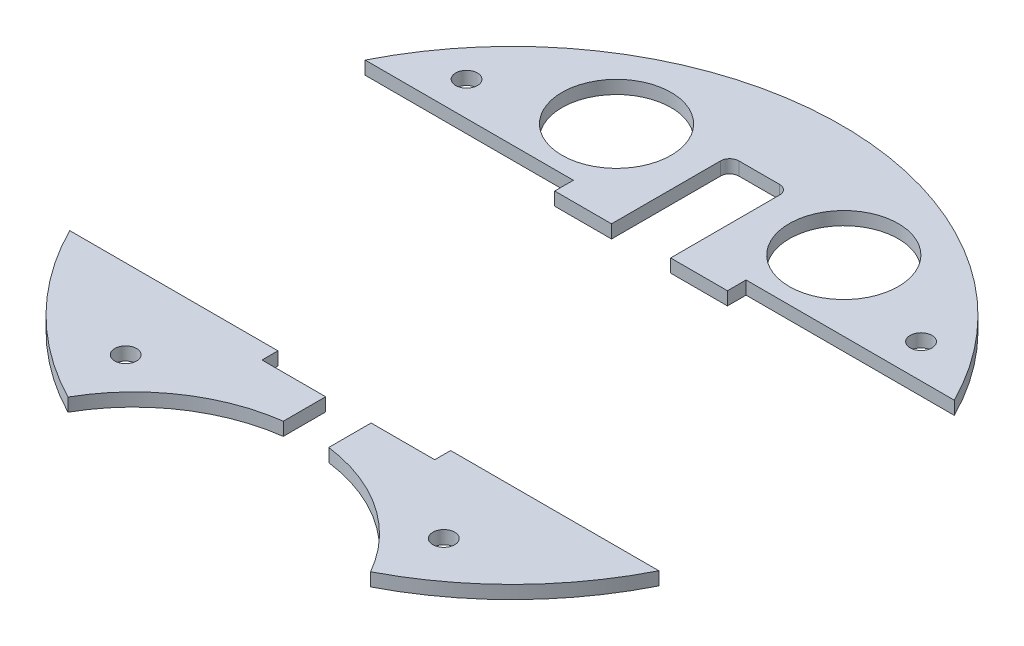
from build123d import *

# Parameters (mm, degrees)
BOSS_EXTRUDE1_DEPTH  = 2.9
SOLENOID_PLACEMENT_W = 38
SOLENOID_PLACEMENT_H = 64.4
CUT_EXTRUDE1_DEPTH   = 103.571487266
CUT_EXTRUDE4_DEPTH   = 103.571487266
SKETCH5_R            = 12
CUT_EXTRUDE5_DEPTH   = 103.571487266
SKETCH6_R            = 2.4
CUT_EXTRUDE6_DEPTH   = 103.571487266
SKETCH7_W            = 10
SKETCH7_H            = 62.80248699
CUT_EXTRUDE7_DEPTH   = 103.571487266
CUT_EXTRUDE3_DEPTH   = 103.571487266


with BuildPart() as part:
    # Sketch1 → Boss-Extrude1 (new body)
    with BuildSketch(Plane(origin=(0, 0, 0), x_dir=(1, 0, 0), z_dir=(0, 1, 0))):
        with BuildLine():
            ThreePointArc((33.29110537, -64.404598464), (0, 72.5), (-33.29110537, -64.404598464))
            ThreePointArc((-33.29110537, -64.404598464), (0, -44.989799638), (33.29110537, -64.404598464))
        make_face()
    extrude(amount=BOSS_EXTRUDE1_DEPTH)

    # solenoid placement → Cut-Extrude1 (cut, through all)
    with BuildSketch(Plane(origin=(0, 2.9, 0), x_dir=(1, 0, 0), z_dir=(0, 1, 0))):
        with Locations((0, -3.8)):
            Rectangle(SOLENOID_PLACEMENT_W, SOLENOID_PLACEMENT_H)
    extrude(amount=-CUT_EXTRUDE1_DEPTH, mode=Mode.SUBTRACT)

    # Sketch4 → Cut-Extrude4 (cut, through all)
    with BuildSketch(Plane(origin=(0, 2.9, 0), x_dir=(1, 0, 0), z_dir=(0, 1, 0))):
        with BuildLine():
            Line((-6.5, 28.1), (6.5, 28.1))
            Line((6.5, 28.1), (6.5, 52.4))
            ThreePointArc((6.5, 52.4), (5.914213562, 53.814213562), (4.5, 54.4))
            Line((4.5, 54.4), (-4.5, 54.4))
            ThreePointArc((-4.5, 54.4), (-5.914213562, 53.814213562), (-6.5, 52.4))
            Line((-6.5, 52.4), (-6.5, 28.1))
        make_face()
    extrude(amount=-CUT_EXTRUDE4_DEPTH, mode=Mode.SUBTRACT)

    # Sketch5 → Cut-Extrude5 (cut, through all)
    with BuildSketch(Plane(origin=(0, 2.9, 0), x_dir=(1, 0, 0), z_dir=(0, 1, 0))):
        with Locations((25, 48)):
            Circle(SKETCH5_R)
        with Locations((-25, 48)):
            Circle(SKETCH5_R)
    extrude(amount=-CUT_EXTRUDE5_DEPTH, mode=Mode.SUBTRACT)

    # Sketch6 → Cut-Extrude6 (cut, through all)
    with BuildSketch(Plane(origin=(0, 2.9, 0), x_dir=(1, 0, 0), z_dir=(0, 1, 0))):
        with Locations((35, -50)):
            Circle(SKETCH6_R)
        with Locations((-35, -50)):
            Circle(SKETCH6_R)
        with Locations((-50, 40)):
            Circle(SKETCH6_R)
        with Locations((50, 40)):
            Circle(SKETCH6_R)
    extrude(amount=-CUT_EXTRUDE6_DEPTH, mode=Mode.SUBTRACT)

    # Sketch7 → Cut-Extrude7 (cut, through all)
    with BuildSketch(Plane(origin=(0, 2.9, 0), x_dir=(1, 0, 0), z_dir=(0, 1, 0))):
        with Locations((0, -31.401243495)):
            Rectangle(SKETCH7_W, SKETCH7_H)
    extrude(amount=-CUT_EXTRUDE7_DEPTH, mode=Mode.SUBTRACT)

    # Sketch3 → Cut-Extrude3 (cut, through all)
    with BuildSketch(Plane(origin=(0, 2.9, 0), x_dir=(1, 0, 0), z_dir=(0, 1, 0))):
        Polygon((-19, 28.4), (19, 28.4), (19, 32.5), (72.5, 32.5), (72.5, -32.5), (-72.5, -32.5), (-72.5, 32.5), (-19, 32.5), align=None)
    extrude(amount=-CUT_EXTRUDE3_DEPTH, mode=Mode.SUBTRACT)


with BuildPart() as cut_extrude3_piece_1:
    # of the separate pieces the step leaves, piece 1, a body of its own (cut_extrude3_pieces)
    add(part.part.solids().sort_by_distance((19, 0, -32.5))[0])


with BuildPart() as cut_extrude3_piece_2:
    # of the separate pieces the step leaves, piece 2, a body of its own (cut_extrude3_pieces)
    add(part.part.solids().sort_by_distance((-33.29110537, 0, 64.404598464))[0])


with BuildPart() as cut_extrude3_piece_3:
    # of the separate pieces the step leaves, piece 3, a body of its own (cut_extrude3_pieces)
    add(part.part.solids().sort_by_distance((5, 0, 45.318005113))[0])


solid = Compound([cut_extrude3_piece_1.part, cut_extrude3_piece_2.part, cut_extrude3_piece_3.part])
